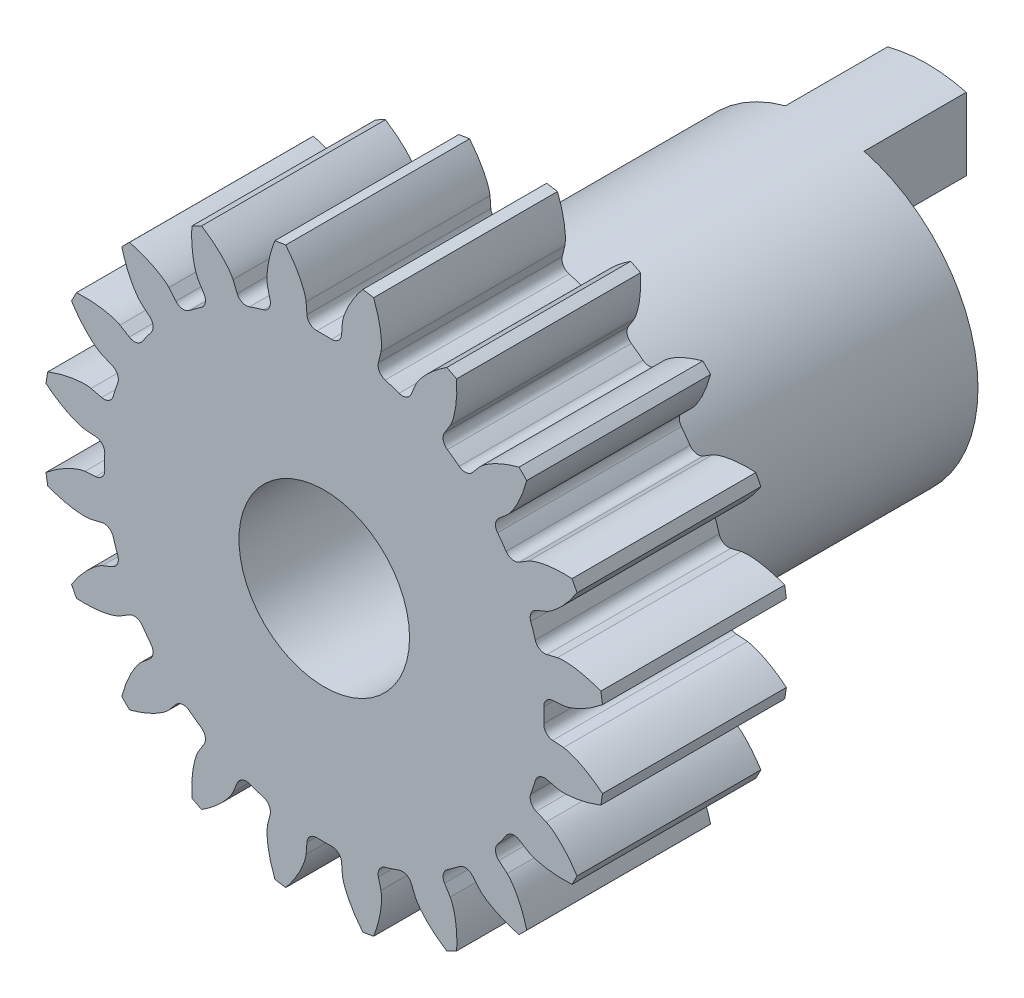
from build123d import *

# Parameters (mm, degrees)
BLANK_SKETCH_R      = 13.75
BLANK_DEPTH         = 9
TOOTH_SPACE_DEPTH   = 22.427202337
TEETH_COUNT         = 20
BORE_DEPTH          = 22.260792111
BORE_DEPTH_BACK     = 22.260792111
BORE_SKETCH_R       = 4.175
BOSS_EXTRUDE1_START = -50.25
SKETCH1_R           = 7.5
SKETCH1_R_2         = 4.175
BOSS_EXTRUDE1_DEPTH = 50.25
CUT_EXTRUDE1_DEPTH  = 5


with BuildPart() as part:
    # Blank Sketch → Blank (new body)
    with BuildSketch(Plane.XY):
        Circle(BLANK_SKETCH_R)
    extrude(amount=BLANK_DEPTH)

    # Tooth Space Sketch → Tooth Space (cut, symmetric)
    with BuildSketch(Plane.XY):
        with BuildLine():
            Line((11.712575542, 0.887578892), (11.182881902, 0.847438712))
            ThreePointArc((11.182881902, 0.847438712), (10.865110495, 0.690887858), (10.744037928, 0.357979056))
            ThreePointArc((10.744037928, 0.357979056), (10.75, 0), (10.744037928, -0.357979056))
            ThreePointArc((10.744037928, -0.357979056), (10.865110495, -0.690887858), (11.182881902, -0.847438712))
            Line((11.182881902, -0.847438712), (11.712575542, -0.887578892))
            add(Edge.make_bspline(
                [(11.712575542, -0.887578892), (11.718030456, -0.888084575), (11.733302224, -0.889786577), (11.762055049, -0.894123642), (11.808748116, -0.902783585), (11.867871522, -0.916136728), (11.943785045, -0.936044148), (12.032491205, -0.962883715), (12.129128281, -0.995906017), (12.233254944, -1.03560915), (12.336170252, -1.078535303), (12.437866469, -1.124417613), (12.538256203, -1.172869671), (12.658707015, -1.234774129), (12.801489519, -1.313454101), (12.965790887, -1.41181046), (13.148934646, -1.53083847), (13.331913845, -1.659992212), (13.508861665, -1.793481702), (13.683836959, -1.93555224), (13.850418726, -2.078105804), (14.019262166, -2.233337092), (14.17300458, -2.380287394), (14.340363277, -2.552637942), (14.474017151, -2.69399985), (14.607838338, -2.84630742), (14.672335873, -2.921355394), (14.70502791, -2.960093607)],
                knots=[0, 0, 0, 0, 0, 0.005376749, 0.015083688, 0.02853182, 0.046610139, 0.064854849, 0.092110525, 0.119476176, 0.146842496, 0.174208854, 0.201574956, 0.228941013, 0.256307345, 0.307035032, 0.361767352, 0.41649966, 0.471231936, 0.525964282, 0.580696615, 0.635428982, 0.690161387, 0.744893688, 0.799626082, 0.854358408, 0.909090915, 0.909090915, 0.909090915, 0.909090915, 0.909090915], degree=4))
            Line((14.70502791, -2.960093607), (14.70502791, 2.960093607))
            add(Edge.make_bspline(
                [(11.712575542, 0.887578892), (11.718030456, 0.888084575), (11.733302224, 0.889786577), (11.762055049, 0.894123642), (11.808748116, 0.902783585), (11.867871522, 0.916136728), (11.943785045, 0.936044148), (12.032491205, 0.962883715), (12.129128281, 0.995906017), (12.233254944, 1.03560915), (12.336170252, 1.078535303), (12.437866469, 1.124417613), (12.538256203, 1.172869671), (12.658707015, 1.234774129), (12.801489519, 1.313454101), (12.965790887, 1.41181046), (13.148934646, 1.53083847), (13.331913845, 1.659992212), (13.508861665, 1.793481702), (13.683836959, 1.93555224), (13.850418726, 2.078105804), (14.019262166, 2.233337092), (14.17300458, 2.380287394), (14.340363277, 2.552637942), (14.474017151, 2.69399985), (14.607838338, 2.84630742), (14.672335873, 2.921355394), (14.70502791, 2.960093607)],
                knots=[0, 0, 0, 0, 0, 0.005376749, 0.015083688, 0.02853182, 0.046610139, 0.064854849, 0.092110525, 0.119476176, 0.146842496, 0.174208854, 0.201574956, 0.228941013, 0.256307345, 0.307035032, 0.361767352, 0.41649966, 0.471231936, 0.525964282, 0.580696615, 0.635428982, 0.690161387, 0.744893688, 0.799626082, 0.854358408, 0.909090915, 0.909090915, 0.909090915, 0.909090915, 0.909090915], degree=4))
        make_face()
    tooth_space = extrude(amount=TOOTH_SPACE_DEPTH, both=True, mode=Mode.SUBTRACT)

    # Teeth: Tooth Space ×20 about axis
    teeth_axis = Axis((0, 0, -43.762507), (0, 0, 1))
    for i in range(1, TEETH_COUNT):
        add(tooth_space.rotate(teeth_axis, i * 360 / TEETH_COUNT), mode=Mode.SUBTRACT)

    # Bore Sketch → Bore (cut, two sides: drawn at the far end of the back side and taken through both)
    with BuildSketch(Plane.XY.offset(-BORE_DEPTH_BACK)):
        Circle(BORE_SKETCH_R)
    extrude(amount=BORE_DEPTH + BORE_DEPTH_BACK, mode=Mode.SUBTRACT)

    # Sketch1 → Boss-Extrude1 (add)
    with BuildSketch(Plane.XY.offset(9).offset(BOSS_EXTRUDE1_START)):
        Circle(SKETCH1_R)
        Circle(SKETCH1_R_2, mode=Mode.SUBTRACT)
    extrude(amount=BOSS_EXTRUDE1_DEPTH)

    # Split1
    split(bisect_by=Plane.XY.offset(-20.5), keep=Keep.TOP)

    # Sketch2 → Cut-Extrude1 (cut)
    with BuildSketch(Plane(origin=(0, 0, -20.5), x_dir=(-1, 0, 0), z_dir=(0, 0, -1))):
        with BuildLine():
            Line((-1.925, 7.248749892), (-1.925, -7.248749892))
            ThreePointArc((-1.925, -7.248749892), (-7.5, 0), (-1.925, 7.248749892))
        make_face()
        with BuildLine():
            Line((1.925, 7.248749892), (1.925, -7.248749892))
            ThreePointArc((1.925, -7.248749892), (7.5, 0), (1.925, 7.248749892))
        make_face()
    extrude(amount=-CUT_EXTRUDE1_DEPTH, mode=Mode.SUBTRACT)


solid = part.part
